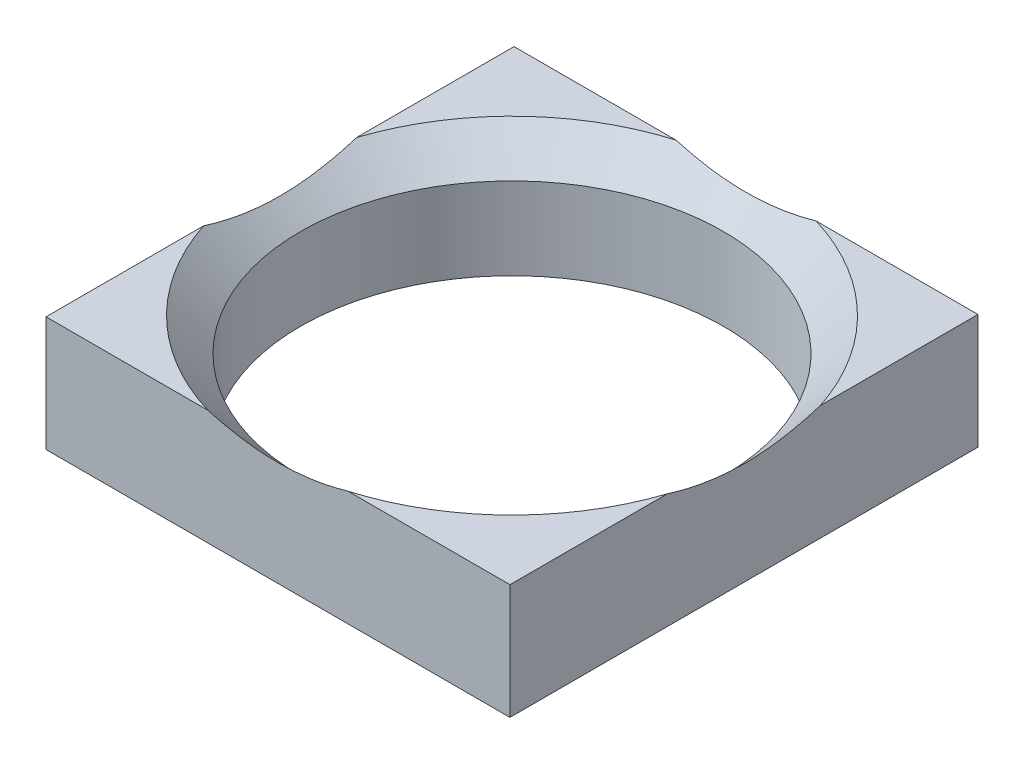
from build123d import *

# Parameters (mm, degrees)
SKETCH_1_W          = 11.9
SKETCH_1_H          = 11.9
SKETCH_1_R          = 5.05
EXTRUDE_1_DEPTH     = 2.8
CHAMFER_1_SIZE      = 0.9
SKETCH1_OUTSIDE_W   = 17.312
SKETCH1_OUTSIDE_H   = 17.312
SKETCH1_OUTSIDE_W_2 = 11.3
SKETCH1_OUTSIDE_H_2 = 11.4
CUT_EXTRUDE1_DEPTH  = 9.868201622
SKETCH2_R           = 5.15
CUT_EXTRUDE2_DEPTH  = 9.500147058


with BuildPart() as part:
    # 草图1 → 凸台-拉伸1 (new body)
    with BuildSketch(Plane(origin=(0, 0, 0), x_dir=(1, 0, 0), z_dir=(0, 1, 0))):
        Rectangle(SKETCH_1_W, SKETCH_1_H)
        with Locations(Location((0, 0, 0), (0, 0, 270))):
            Circle(SKETCH_1_R, mode=Mode.SUBTRACT)
    extrude(amount=EXTRUDE_1_DEPTH)

    # 倒角1
    chamfer_1_edges = [part.edges().sort_by_distance(p)[0] for p in [
        (0, 2.8, -5.05),
    ]]
    chamfer(chamfer_1_edges, length=CHAMFER_1_SIZE - 0.0001)  # a hair under: the kernel refuses the full size

    # Sketch1 outside → Cut-Extrude1 (cut, through all)
    with BuildSketch(Plane(origin=(0, 2.8, 0), x_dir=(1, 0, 0), z_dir=(0, 1, 0))):
        Rectangle(SKETCH1_OUTSIDE_W, SKETCH1_OUTSIDE_H)
        Rectangle(SKETCH1_OUTSIDE_W_2, SKETCH1_OUTSIDE_H_2, mode=Mode.SUBTRACT)
    extrude(amount=-CUT_EXTRUDE1_DEPTH, mode=Mode.SUBTRACT)

    # Sketch2 → Cut-Extrude2 (cut, through all)
    with BuildSketch(Plane(origin=(0, 2.8, 0), x_dir=(1, 0, 0), z_dir=(0, 1, 0))):
        with Locations(Location((0, 0, 0), (0, 0, 270))):
            Circle(SKETCH2_R)
    extrude(amount=-CUT_EXTRUDE2_DEPTH, mode=Mode.SUBTRACT)


solid = part.part
